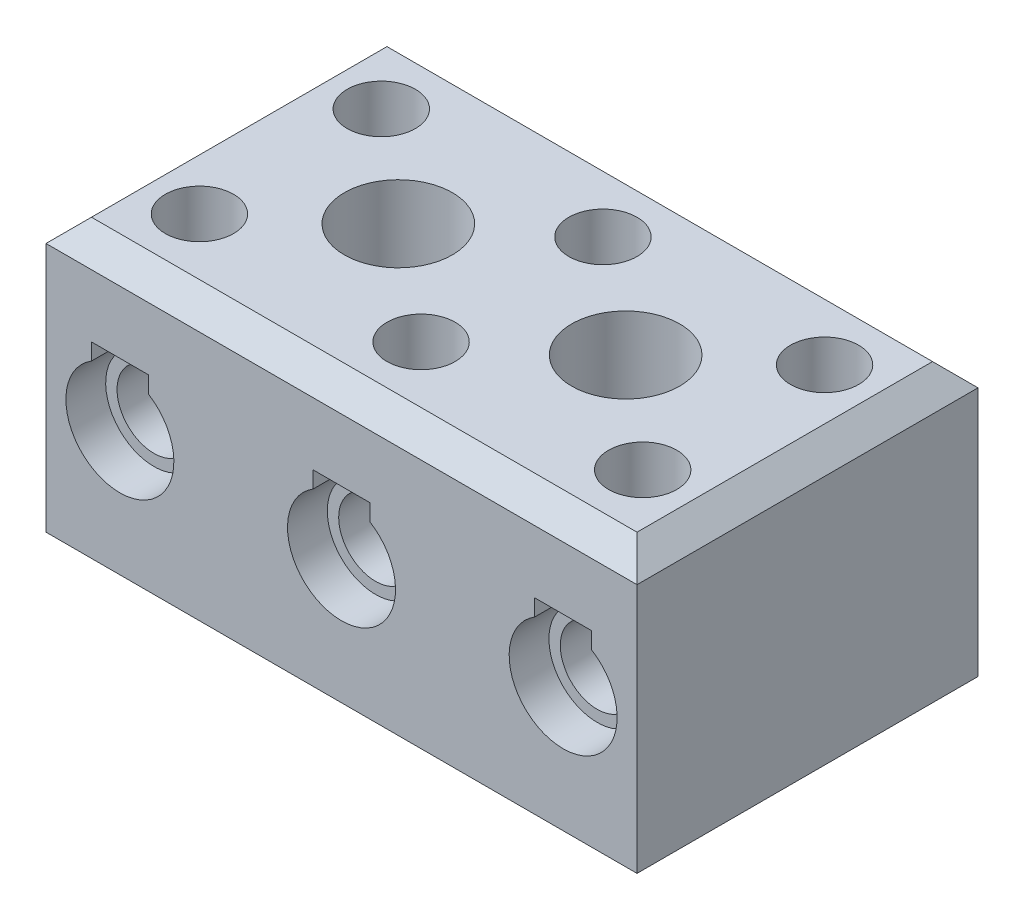
from build123d import *

# Parameters (mm, degrees)
SKETCH1_W             = 52
SKETCH1_H             = 30
SKETCH1_R             = 2.75
BOSS_EXTRUDE1_DEPTH   = 24
CHAMFER1_SIZE         = 2
CUT_EXTRUDE1_START    = -12
SKETCH4_R             = 4.75
SKETCH4_R_2           = 2.75
CUT_EXTRUDE1_DEPTH    = 12
CUT_EXTRUDE2_DEPTH    = 47.389654019
SKETCH6_R             = 3
CUT_EXTRUDE3_DEPTH    = 10
SKETCH7_R             = 3.25
BOSS_EXTRUDE2_DEPTH   = 24
BOSS_EXTRUDE3_START   = -5
SKETCH8_R             = 1.5
BOSS_EXTRUDE3_DEPTH   = 9
SKETCH9_R             = 2.5
BOSS_EXTRUDE4_DEPTH   = 2.5
SKETCH11_W            = 5
SKETCH11_H            = 1.5
CUT_EXTRUDE4_DEPTH    = 1.5
LPATTERN5_START       = 14.250000103
LPATTERN5_OUTLINE_W   = 4
LPATTERN5_OUTLINE_H   = 24
LPATTERN5_DEPTH       = 1.749999897
LPATTERN5_START_2     = 11
LPATTERN5_2_OUTLINE_R = 1.5
LPATTERN5_2_DEPTH     = 7.5
LPATTERN5_START_3     = 17.5
LPATTERN5_3_DEPTH     = 2.5
LPATTERN5_4_DEPTH     = 1
LPATTERN5_START_4     = -12
LPATTERN5_5_OUTLINE_R = 3.25
LPATTERN5_5_DEPTH     = 24
LPATTERN5_START_5     = 14.682738072
LPATTERN5_6_OUTLINE_R = 3
LPATTERN5_6_DEPTH     = 9.317261928
LPATTERN5_7_DEPTH     = 1.817261928
LPATTERN5_START_6     = -15
LPATTERN5_8_DEPTH     = 30
LPATTERN6_START       = 14.250000103
LPATTERN6_OUTLINE_W   = 4
LPATTERN6_OUTLINE_H   = 24
LPATTERN6_DEPTH       = 1.749999897
LPATTERN6_START_2     = 11
LPATTERN6_2_OUTLINE_R = 1.5
LPATTERN6_2_DEPTH     = 7.5
LPATTERN6_START_3     = 17.5
LPATTERN6_3_DEPTH     = 2.5
LPATTERN6_4_DEPTH     = 1
LPATTERN6_START_4     = -12
LPATTERN6_5_OUTLINE_R = 3.25
LPATTERN6_5_DEPTH     = 24
LPATTERN6_START_5     = 14.682738072
LPATTERN6_6_OUTLINE_R = 3
LPATTERN6_6_DEPTH     = 9.317261928
LPATTERN6_7_DEPTH     = 1.817261928
LPATTERN6_START_6     = -15
LPATTERN6_8_DEPTH     = 30


with BuildPart() as part:
    # Sketch1 → Boss-Extrude1 (new body)
    with BuildSketch(Plane(origin=(0, 0, 0), x_dir=(1, 0, 0), z_dir=(0, 1, 0))):
        Rectangle(SKETCH1_W, SKETCH1_H)
        with Locations(Location((-10, 0, 0), (0, 0, 270))):
            Circle(SKETCH1_R, mode=Mode.SUBTRACT)
        with Locations(Location((10, 0, 0), (0, 0, 270))):
            Circle(SKETCH1_R, mode=Mode.SUBTRACT)
    extrude(amount=BOSS_EXTRUDE1_DEPTH)

    # Chamfer1
    chamfer1_edges = [part.edges().sort_by_distance(p)[0] for p in [
        (26, 24, 0),
        (0, 24, -15),
        (-26, 24, 0),
        (0, 24, 15),
    ]]
    chamfer(chamfer1_edges, length=CHAMFER1_SIZE)

    # Sketch4 → Cut-Extrude1 (cut)
    # profile 1 of 2: a face of its own
    with BuildSketch(Plane(origin=(0, 24, 0), x_dir=(1, 0, 0), z_dir=(0, 1, 0)).offset(CUT_EXTRUDE1_START)):
        with Locations(Location((-10, 0, 0), (0, 0, 270))):
            Circle(SKETCH4_R)
        with Locations(Location((-10, 0, 0), (0, 0, 270))):
            Circle(SKETCH4_R_2, mode=Mode.SUBTRACT)
    # profile 2 of 2: a face of its own
    with BuildSketch(Plane(origin=(0, 24, 0), x_dir=(1, 0, 0), z_dir=(0, 1, 0)).offset(CUT_EXTRUDE1_START)):
        with Locations(Location((10, 0, 0), (0, 0, 270))):
            Circle(SKETCH4_R)
        with Locations(Location((10, 0, 0), (0, 0, 270))):
            Circle(SKETCH4_R_2, mode=Mode.SUBTRACT)
    extrude(amount=CUT_EXTRUDE1_DEPTH, mode=Mode.SUBTRACT)

    # Sketch5 → Cut-Extrude2 (cut, symmetric)
    with BuildSketch(Plane.XY.offset(15)):
        with BuildLine():
            Line((-2.5, 16.5), (2.5, 16.5))
            Line((2.5, 16.5), (2.5, 15.038873605))
            ThreePointArc((2.5, 15.038873605), (0, 6.25), (-2.5, 15.038873605))
            Line((-2.5, 15.038873605), (-2.5, 16.5))
        make_face()
    extrude(amount=CUT_EXTRUDE2_DEPTH, both=True, mode=Mode.SUBTRACT)

    # Sketch6 → Cut-Extrude3 (cut)
    with BuildSketch(Plane(origin=(0, 24, 0), x_dir=(1, 0, 0), z_dir=(0, 1, 0))):
        with Locations(Location((0, 8, 0), (0, 0, 270))):
            Circle(SKETCH6_R)
        with Locations(Location((0, -8, 0), (0, 0, 270))):
            Circle(SKETCH6_R)
    extrude(amount=-CUT_EXTRUDE3_DEPTH, mode=Mode.SUBTRACT)

    # LPattern5 6 outline → LPattern5 6 (cut)
    with BuildSketch(Plane(origin=(0, 0, 0), x_dir=(1, 0, 0), z_dir=(0, 1, 0)).offset(LPATTERN5_START_5)):
        with Locations((-19.5, 8)):
            Circle(LPATTERN5_6_OUTLINE_R)
        with Locations((-19.5, -8)):
            Circle(LPATTERN5_6_OUTLINE_R)
    extrude(amount=LPATTERN5_6_DEPTH, mode=Mode.SUBTRACT)

    # LPattern5 7 outline → LPattern5 7 (cut)
    with BuildSketch(Plane(origin=(0, 0, 0), x_dir=(1, 0, 0), z_dir=(0, 1, 0)).offset(LPATTERN5_START_5)):
        with BuildLine():
            ThreePointArc((-17, 6.341687605), (-19.5, 5), (-22, 6.341687605))
            Line((-22, 6.341687605), (-22, -6.341687605))
            ThreePointArc((-22, -6.341687605), (-19.5, -5), (-17, -6.341687605))
            Line((-17, -6.341687605), (-17, 6.341687605))
        make_face()
        with BuildLine():
            Line((-22, 15), (-22, 9.658312395))
            ThreePointArc((-22, 9.658312395), (-19.5, 11), (-17, 9.658312395))
            Line((-17, 9.658312395), (-17, 15))
            Line((-17, 15), (-22, 15))
        make_face()
        with BuildLine():
            ThreePointArc((-17, -9.658312395), (-19.5, -11), (-22, -9.658312395))
            Line((-22, -9.658312395), (-22, -15))
            Line((-22, -15), (-17, -15))
            Line((-17, -15), (-17, -9.658312395))
        make_face()
    extrude(amount=LPATTERN5_7_DEPTH, mode=Mode.SUBTRACT)

    # LPattern5 8 outline → LPattern5 8 (cut)
    with BuildSketch(Plane.XY.offset(LPATTERN5_START_6)):
        with BuildLine():
            Line((-22, 14.682738072), (-22, 15.038873605))
            ThreePointArc((-22, 15.038873605), (-22.255757261, 14.868888977), (-22.49999603, 14.682733199))
            Line((-22.49999603, 14.682733199), (-22, 14.682738072))
        make_face()
        with BuildLine():
            Line((-22, 14.682738072), (-22.49999603, 14.682733199))
            ThreePointArc((-22.49999603, 14.682733199), (-19.5, 6.25), (-16.50000397, 14.682733199))
            Line((-16.50000397, 14.682733199), (-17, 14.682738072))
            Line((-17, 14.682738072), (-22, 14.682738072))
        make_face()
        with BuildLine():
            Line((-17, 14.682738072), (-16.50000397, 14.682733199))
            ThreePointArc((-16.50000397, 14.682733199), (-16.744242739, 14.868888977), (-17, 15.038873605))
            Line((-17, 15.038873605), (-17, 14.682738072))
        make_face()
    extrude(amount=LPATTERN5_8_DEPTH, mode=Mode.SUBTRACT)

    # LPattern6 6 outline → LPattern6 6 (cut)
    with BuildSketch(Plane(origin=(0, 0, 0), x_dir=(1, 0, 0), z_dir=(0, 1, 0)).offset(LPATTERN6_START_5)):
        with Locations((19.5, 8)):
            Circle(LPATTERN6_6_OUTLINE_R)
        with Locations((19.5, -8)):
            Circle(LPATTERN6_6_OUTLINE_R)
    extrude(amount=LPATTERN6_6_DEPTH, mode=Mode.SUBTRACT)

    # LPattern6 7 outline → LPattern6 7 (cut)
    with BuildSketch(Plane(origin=(0, 0, 0), x_dir=(1, 0, 0), z_dir=(0, 1, 0)).offset(LPATTERN6_START_5)):
        with BuildLine():
            ThreePointArc((22, 6.341687605), (19.5, 5), (17, 6.341687605))
            Line((17, 6.341687605), (17, -6.341687605))
            ThreePointArc((17, -6.341687605), (19.5, -5), (22, -6.341687605))
            Line((22, -6.341687605), (22, 6.341687605))
        make_face()
        with BuildLine():
            Line((17, 15), (17, 9.658312395))
            ThreePointArc((17, 9.658312395), (19.5, 11), (22, 9.658312395))
            Line((22, 9.658312395), (22, 15))
            Line((22, 15), (17, 15))
        make_face()
        with BuildLine():
            ThreePointArc((22, -9.658312395), (19.5, -11), (17, -9.658312395))
            Line((17, -9.658312395), (17, -15))
            Line((17, -15), (22, -15))
            Line((22, -15), (22, -9.658312395))
        make_face()
    extrude(amount=LPATTERN6_7_DEPTH, mode=Mode.SUBTRACT)

    # LPattern6 8 outline → LPattern6 8 (cut)
    with BuildSketch(Plane.XY.offset(LPATTERN6_START_6)):
        with BuildLine():
            Line((17, 14.682738072), (17, 15.038873605))
            ThreePointArc((17, 15.038873605), (16.744242739, 14.868888977), (16.50000397, 14.682733199))
            Line((16.50000397, 14.682733199), (17, 14.682738072))
        make_face()
        with BuildLine():
            Line((17, 14.682738072), (16.50000397, 14.682733199))
            ThreePointArc((16.50000397, 14.682733199), (19.5, 6.25), (22.49999603, 14.682733199))
            Line((22.49999603, 14.682733199), (22, 14.682738072))
            Line((22, 14.682738072), (17, 14.682738072))
        make_face()
        with BuildLine():
            Line((22, 14.682738072), (22.49999603, 14.682733199))
            ThreePointArc((22.49999603, 14.682733199), (22.255757261, 14.868888977), (22, 15.038873605))
            Line((22, 15.038873605), (22, 14.682738072))
        make_face()
    extrude(amount=LPATTERN6_8_DEPTH, mode=Mode.SUBTRACT)


with BuildPart() as body_2:
    # Sketch7 → Boss-Extrude2 (new body)
    with BuildSketch(Plane(origin=(0, 0, -12), x_dir=(-1, 0, 0), z_dir=(0, 0, -1))):
        with BuildLine():
            Line((-2, 14.75), (-2, 16))
            Line((-2, 16), (2, 16))
            Line((2, 16), (2, 14.75))
            ThreePointArc((2, 14.75), (0, 6.75), (-2, 14.75))
        make_face()
        with Locations((0, 11)):
            Circle(SKETCH7_R, mode=Mode.SUBTRACT)
    extrude(amount=-BOSS_EXTRUDE2_DEPTH)

    # Sketch8 → Boss-Extrude3 (add)
    with BuildSketch(Plane(origin=(0, 16, 0), x_dir=(1, 0, 0), z_dir=(0, 1, 0)).offset(BOSS_EXTRUDE3_START)):
        with Locations(Location((0, -8, 0), (0, 0, 270))):
            Circle(SKETCH8_R)
        with Locations(Location((0, 8, 0), (0, 0, 270))):
            Circle(SKETCH8_R)
    extrude(amount=BOSS_EXTRUDE3_DEPTH)

    # Sketch9 → Boss-Extrude4 (add)
    with BuildSketch(Plane(origin=(0, 20, 0), x_dir=(1, 0, 0), z_dir=(0, 1, 0))):
        with Locations(Location((0, -8, 0), (0, 0, 270))):
            Circle(SKETCH9_R)
        with Locations(Location((0, 8, 0), (0, 0, 270))):
            Circle(SKETCH9_R)
    extrude(amount=-BOSS_EXTRUDE4_DEPTH)

    # Sketch11 → Cut-Extrude4 (cut)
    with BuildSketch(Plane(origin=(0, 20, 0), x_dir=(1, 0, 0), z_dir=(0, 1, 0))):
        with Locations((0, -8)):
            Rectangle(SKETCH11_W, SKETCH11_H)
        with Locations((0, 8)):
            Rectangle(SKETCH11_W, SKETCH11_H)
    extrude(amount=-CUT_EXTRUDE4_DEPTH, mode=Mode.SUBTRACT)


with BuildPart() as body_3:
    # LPattern5: read off the stored shape, not the designer's step
    # LPattern5 outline → LPattern5 (new body)
    with BuildSketch(Plane(origin=(0, 0, 0), x_dir=(1, 0, 0), z_dir=(0, 1, 0)).offset(LPATTERN5_START)):
        with Locations((-19.5, 0)):
            Rectangle(LPATTERN5_OUTLINE_W, LPATTERN5_OUTLINE_H)
    extrude(amount=LPATTERN5_DEPTH)

    # LPattern5 2 outline → LPattern5 2 (add)
    with BuildSketch(Plane(origin=(0, 0, 0), x_dir=(1, 0, 0), z_dir=(0, 1, 0)).offset(LPATTERN5_START_2)):
        with Locations((-19.5, 8)):
            Circle(LPATTERN5_2_OUTLINE_R)
        with Locations((-19.5, -8)):
            Circle(LPATTERN5_2_OUTLINE_R)
    extrude(amount=LPATTERN5_2_DEPTH)

    # LPattern5 3 outline → LPattern5 3 (add)
    with BuildSketch(Plane(origin=(0, 0, 0), x_dir=(1, 0, 0), z_dir=(0, 1, 0)).offset(LPATTERN5_START_3)):
        with BuildLine():
            ThreePointArc((-17.115151996, 8.75), (-19.5, 10.5), (-21.884848004, 8.75))
            Line((-21.884848004, 8.75), (-17.115151996, 8.75))
        make_face()
        with BuildLine():
            ThreePointArc((-21.884848004, 7.25), (-19.5, 5.5), (-17.115151996, 7.25))
            Line((-17.115151996, 7.25), (-21.884848004, 7.25))
        make_face()
        with BuildLine():
            ThreePointArc((-17.115151996, -7.25), (-19.5, -5.5), (-21.884848004, -7.25))
            Line((-21.884848004, -7.25), (-17.115151996, -7.25))
        make_face()
        with BuildLine():
            Line((-17.115151996, -8.75), (-21.884848004, -8.75))
            ThreePointArc((-21.884848004, -8.75), (-19.5, -10.5), (-17.115151996, -8.75))
        make_face()
    extrude(amount=LPATTERN5_3_DEPTH)

    # LPattern5 4 outline → LPattern5 4 (add)
    with BuildSketch(Plane(origin=(0, 0, 0), x_dir=(1, 0, 0), z_dir=(0, 1, 0)).offset(LPATTERN5_START_3)):
        with BuildLine():
            ThreePointArc((-18.200961894, 8.75), (-18, 8), (-18.200961894, 7.25))
            Line((-18.200961894, 7.25), (-17.115151996, 7.25))
            ThreePointArc((-17.115151996, 7.25), (-17, 8), (-17.115151996, 8.75))
            Line((-17.115151996, 8.75), (-18.200961894, 8.75))
        make_face()
        with BuildLine():
            ThreePointArc((-20.799038106, 7.25), (-21, 8), (-20.799038106, 8.75))
            Line((-20.799038106, 8.75), (-21.884848004, 8.75))
            ThreePointArc((-21.884848004, 8.75), (-22, 8), (-21.884848004, 7.25))
            Line((-21.884848004, 7.25), (-20.799038106, 7.25))
        make_face()
        with BuildLine():
            Line((-17.115151996, -7.25), (-18.200961894, -7.25))
            ThreePointArc((-18.200961894, -7.25), (-18, -8), (-18.200961894, -8.75))
            Line((-18.200961894, -8.75), (-17.115151996, -8.75))
            ThreePointArc((-17.115151996, -8.75), (-17, -8), (-17.115151996, -7.25))
        make_face()
        with BuildLine():
            Line((-20.799038106, -7.25), (-21.884848004, -7.25))
            ThreePointArc((-21.884848004, -7.25), (-22, -8), (-21.884848004, -8.75))
            Line((-21.884848004, -8.75), (-20.799038106, -8.75))
            ThreePointArc((-20.799038106, -8.75), (-21, -8), (-20.799038106, -7.25))
        make_face()
    extrude(amount=LPATTERN5_4_DEPTH)

    # LPattern5 5 outline → LPattern5 5 (add)
    with BuildSketch(Plane.XY.offset(LPATTERN5_START_4)):
        with BuildLine():
            ThreePointArc((-21.5, 14.75), (-19.5, 6.75), (-17.5, 14.75))
            Line((-17.5, 14.75), (-17.5, 16))
            Line((-17.5, 16), (-21.5, 16))
            Line((-21.5, 16), (-21.5, 14.75))
        make_face()
        with Locations((-19.5, 11)):
            Circle(LPATTERN5_5_OUTLINE_R, mode=Mode.SUBTRACT)
    extrude(amount=LPATTERN5_5_DEPTH)


with BuildPart() as body_4:
    # LPattern6: read off the stored shape, not the designer's step
    # LPattern6 outline → LPattern6 (new body)
    with BuildSketch(Plane(origin=(0, 0, 0), x_dir=(1, 0, 0), z_dir=(0, 1, 0)).offset(LPATTERN6_START)):
        with Locations((19.5, 0)):
            Rectangle(LPATTERN6_OUTLINE_W, LPATTERN6_OUTLINE_H)
    extrude(amount=LPATTERN6_DEPTH)

    # LPattern6 2 outline → LPattern6 2 (add)
    with BuildSketch(Plane(origin=(0, 0, 0), x_dir=(1, 0, 0), z_dir=(0, 1, 0)).offset(LPATTERN6_START_2)):
        with Locations((19.5, 8)):
            Circle(LPATTERN6_2_OUTLINE_R)
        with Locations((19.5, -8)):
            Circle(LPATTERN6_2_OUTLINE_R)
    extrude(amount=LPATTERN6_2_DEPTH)

    # LPattern6 3 outline → LPattern6 3 (add)
    with BuildSketch(Plane(origin=(0, 0, 0), x_dir=(1, 0, 0), z_dir=(0, 1, 0)).offset(LPATTERN6_START_3)):
        with BuildLine():
            ThreePointArc((21.884848004, 8.75), (19.5, 10.5), (17.115151996, 8.75))
            Line((17.115151996, 8.75), (21.884848004, 8.75))
        make_face()
        with BuildLine():
            ThreePointArc((17.115151996, 7.25), (19.5, 5.5), (21.884848004, 7.25))
            Line((21.884848004, 7.25), (17.115151996, 7.25))
        make_face()
        with BuildLine():
            ThreePointArc((21.884848004, -7.25), (19.5, -5.5), (17.115151996, -7.25))
            Line((17.115151996, -7.25), (21.884848004, -7.25))
        make_face()
        with BuildLine():
            Line((21.884848004, -8.75), (17.115151996, -8.75))
            ThreePointArc((17.115151996, -8.75), (19.5, -10.5), (21.884848004, -8.75))
        make_face()
    extrude(amount=LPATTERN6_3_DEPTH)

    # LPattern6 4 outline → LPattern6 4 (add)
    with BuildSketch(Plane(origin=(0, 0, 0), x_dir=(1, 0, 0), z_dir=(0, 1, 0)).offset(LPATTERN6_START_3)):
        with BuildLine():
            ThreePointArc((20.799038106, 8.75), (21, 8), (20.799038106, 7.25))
            Line((20.799038106, 7.25), (21.884848004, 7.25))
            ThreePointArc((21.884848004, 7.25), (22, 8), (21.884848004, 8.75))
            Line((21.884848004, 8.75), (20.799038106, 8.75))
        make_face()
        with BuildLine():
            ThreePointArc((18.200961894, 7.25), (18, 8), (18.200961894, 8.75))
            Line((18.200961894, 8.75), (17.115151996, 8.75))
            ThreePointArc((17.115151996, 8.75), (17, 8), (17.115151996, 7.25))
            Line((17.115151996, 7.25), (18.200961894, 7.25))
        make_face()
        with BuildLine():
            Line((21.884848004, -7.25), (20.799038106, -7.25))
            ThreePointArc((20.799038106, -7.25), (21, -8), (20.799038106, -8.75))
            Line((20.799038106, -8.75), (21.884848004, -8.75))
            ThreePointArc((21.884848004, -8.75), (22, -8), (21.884848004, -7.25))
        make_face()
        with BuildLine():
            Line((18.200961894, -7.25), (17.115151996, -7.25))
            ThreePointArc((17.115151996, -7.25), (17, -8), (17.115151996, -8.75))
            Line((17.115151996, -8.75), (18.200961894, -8.75))
            ThreePointArc((18.200961894, -8.75), (18, -8), (18.200961894, -7.25))
        make_face()
    extrude(amount=LPATTERN6_4_DEPTH)

    # LPattern6 5 outline → LPattern6 5 (add)
    with BuildSketch(Plane.XY.offset(LPATTERN6_START_4)):
        with BuildLine():
            ThreePointArc((17.5, 14.75), (19.5, 6.75), (21.5, 14.75))
            Line((21.5, 14.75), (21.5, 16))
            Line((21.5, 16), (17.5, 16))
            Line((17.5, 16), (17.5, 14.75))
        make_face()
        with Locations((19.5, 11)):
            Circle(LPATTERN6_5_OUTLINE_R, mode=Mode.SUBTRACT)
    extrude(amount=LPATTERN6_5_DEPTH)


solid = Compound([part.part, body_2.part, body_3.part, body_4.part])
